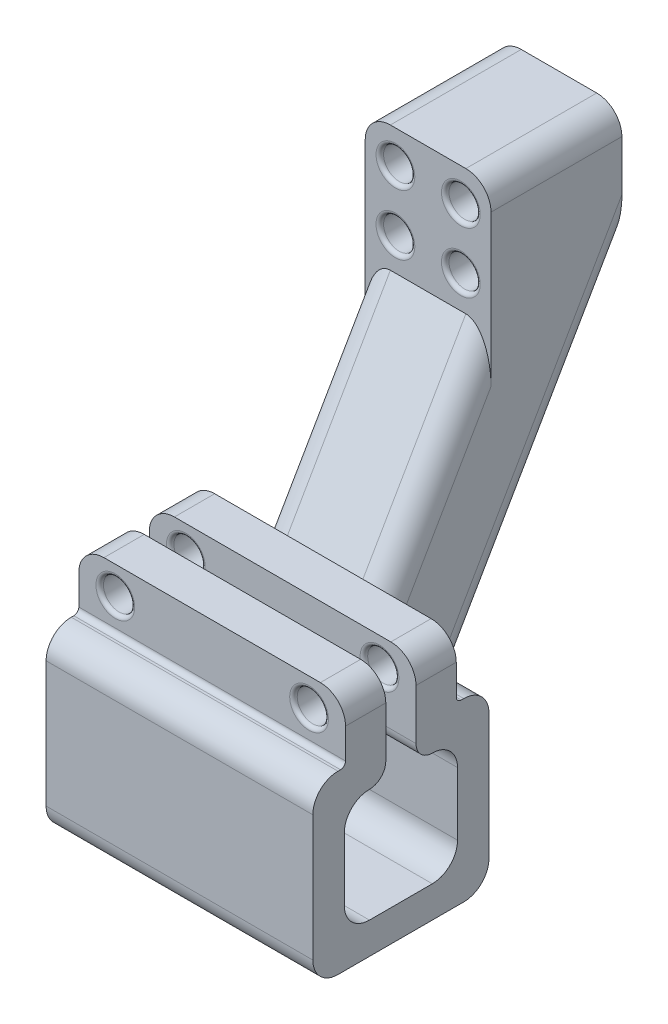
from build123d import *

# Parameters (mm, degrees)
SKETCH1_W           = 35
SKETCH1_H           = 35
BOSS_EXTRUDE1_DEPTH = 26.5
FILLET1_R           = 5
BOSS_EXTRUDE2_DEPTH = 12.5
SKETCH3_W           = 25
SKETCH3_H           = 26.003856124
BOSS_EXTRUDE3_DEPTH = 25
CUT_EXTRUDE1_REACH  = 98.127
SKETCH4_W           = 53
SKETCH4_H           = 6
SKETCH5_W           = 53
SKETCH5_H           = 8
BOSS_EXTRUDE4_DEPTH = 12
SKETCH6_R           = 3.1
CUT_EXTRUDE2_DEPTH  = 117.024613369
FILLET4_R           = 1
FILLET2_R           = 5
FILLET5_R           = 3.25
FILLET6_R           = 0.75
FILLET13_R          = 5


with BuildPart() as part:
    # Sketch1 → Boss-Extrude1 (new, symmetric)
    with BuildSketch(Plane(origin=(0, 0, 0), x_dir=(0, 0, -1), z_dir=(1, 0, 0))):
        Rectangle(SKETCH1_W, SKETCH1_H)
        with BuildLine():
            Line((-6.25, -11.25), (6.25, -11.25))
            ThreePointArc((6.25, -11.25), (9.785533906, -9.785533906), (11.25, -6.25))
            Line((11.25, -6.25), (11.25, 6.25))
            ThreePointArc((11.25, 6.25), (9.785533906, 9.785533906), (6.25, 11.25))
            Line((6.25, 11.25), (-6.25, 11.25))
            ThreePointArc((-6.25, 11.25), (-9.785533906, 9.785533906), (-11.25, 6.25))
            Line((-11.25, 6.25), (-11.25, -6.25))
            ThreePointArc((-11.25, -6.25), (-9.785533906, -9.785533906), (-6.25, -11.25))
        make_face(mode=Mode.SUBTRACT)
    extrude(amount=BOSS_EXTRUDE1_DEPTH, both=True)

    # Fillet1
    fillet1_edges = [part.edges().sort_by_distance(p)[0] for p in [
        (0, -17.5, -17.5),
        (0, -17.5, 17.5),
        (0, 17.5, 17.5),
    ]]
    fillet(fillet1_edges, radius=FILLET1_R)

    # Sketch2 → Boss-Extrude2 (add, symmetric)
    with BuildSketch(Plane(origin=(0, 0, 0), x_dir=(0, 0, -1), z_dir=(1, 0, 0))):
        Polygon((4.775200067, 17.5), (17.5, 17.5), (17.5, -5.5), (57.914518843, 64.5), (31.910662719, 64.5), align=None)
    extrude(amount=BOSS_EXTRUDE2_DEPTH, both=True)

    # Sketch3 → Boss-Extrude3 (add)
    with BuildSketch(Plane(origin=(0, 64.5, 0), x_dir=(1, 0, 0), z_dir=(0, 1, 0))):
        with Locations((0, 44.912590781)):
            Rectangle(SKETCH3_W, SKETCH3_H)
    extrude(amount=BOSS_EXTRUDE3_DEPTH)

    # Sketch4 → Cut-Extrude1 (cut, up to next)
    with BuildSketch(Plane(origin=(0, 17.5, 0), x_dir=(1, 0, 0), z_dir=(0, 1, 0)), mode=Mode.PRIVATE) as cut_extrude1_sk1:
        Rectangle(SKETCH4_W, SKETCH4_H)
    cut_extrude1_tool1 = extrude(cut_extrude1_sk1.sketch, amount=-CUT_EXTRUDE1_REACH, mode=Mode.PRIVATE) & part.part
    add(cut_extrude1_tool1.solids().sort_by_distance((0, 17.5, 0))[0], mode=Mode.SUBTRACT)

    # Sketch5 → Boss-Extrude4 (add)
    with BuildSketch(Plane(origin=(0, 17.5, 0), x_dir=(1, 0, 0), z_dir=(0, 1, 0))):
        with Locations((0, 7)):
            Rectangle(SKETCH5_W, SKETCH5_H)
        with Locations((0, -7)):
            Rectangle(SKETCH5_W, SKETCH5_H)
    extrude(amount=BOSS_EXTRUDE4_DEPTH)

    # Sketch6 → Cut-Extrude2 (cut, through all)
    with BuildSketch(Plane.XY.offset(11)):
        with Locations((-19.25, 24)):
            Circle(SKETCH6_R)
        with Locations((19.25, 24)):
            Circle(SKETCH6_R)
        with Locations((-6.5, 83)):
            Circle(SKETCH6_R)
        with Locations((-6.5, 71)):
            Circle(SKETCH6_R)
        with Locations(Location((6.5, 71, 0), (0, 0, 180))):
            Circle(SKETCH6_R)
        with Locations(Location((6.5, 83, 0), (0, 0, 180))):
            Circle(SKETCH6_R)
    extrude(amount=-CUT_EXTRUDE2_DEPTH, mode=Mode.SUBTRACT)

    # Fillet4
    fillet4_edges = [part.edges().sort_by_distance(p)[0] for p in [
        (-19.5, 17.5, -11),
        (19.5, 17.5, -11),
        (0, 17.5, 11),
    ]]
    fillet(fillet4_edges, radius=FILLET4_R)

    # Fillet2
    fillet2_edges = [part.edges().sort_by_distance(p)[0] for p in [
        (-26.5, 29.5, -7),
        (26.5, 29.5, -7),
        (-26.5, 29.5, 7),
        (26.5, 29.5, 7),
        (-19.5, 17.5, -17.5),
        (-12.5, 29.5, -37.707259422),
        (12.5, 29.5, -37.707259422),
        (-12.5, 89.5, -44.912590781),
        (12.5, 89.5, -44.912590781),
        (19.5, 17.5, -17.5),
    ]]
    fillet(fillet2_edges, radius=FILLET2_R)

    # Fillet5
    fillet5_edges = [part.edges().sort_by_distance(p)[0] for p in [
        (0, 11.25, -3),
        (0, 11.25, 3),
    ]]
    fillet(fillet5_edges, radius=FILLET5_R - 0.0001)  # a hair under: the kernel refuses the full size

    # Fillet6
    fillet6_edges = [part.edges().sort_by_distance(p)[0] for p in [
        (-22.35, 24, 3),
        (-22.35, 24, -11),
        (-22.35, 24, -3),
        (-22.35, 24, 11),
        (9.6, 83, -57.914518843),
        (9.6, 83, -31.910662719),
        (-9.6, 71, -57.914518843),
        (-9.6, 71, -31.910662719),
        (16.15, 24, 3),
        (16.15, 24, -11),
        (16.15, 24, -3),
        (16.15, 24, 11),
        (-9.6, 83, -57.914518843),
        (-9.6, 83, -31.910662719),
        (9.6, 71, -57.914518843),
        (9.6, 71, -31.910662719),
    ]]
    fillet(fillet6_edges, radius=FILLET6_R)

    # Fillet13
    fillet13_edges = [part.edges().sort_by_distance(p)[0] for p in [
        (12.5, 46.390834875, -21.455331359),
        (-12.5, 46.390834875, -21.455331359),
    ]]
    fillet(fillet13_edges, radius=FILLET13_R)


solid = part.part
